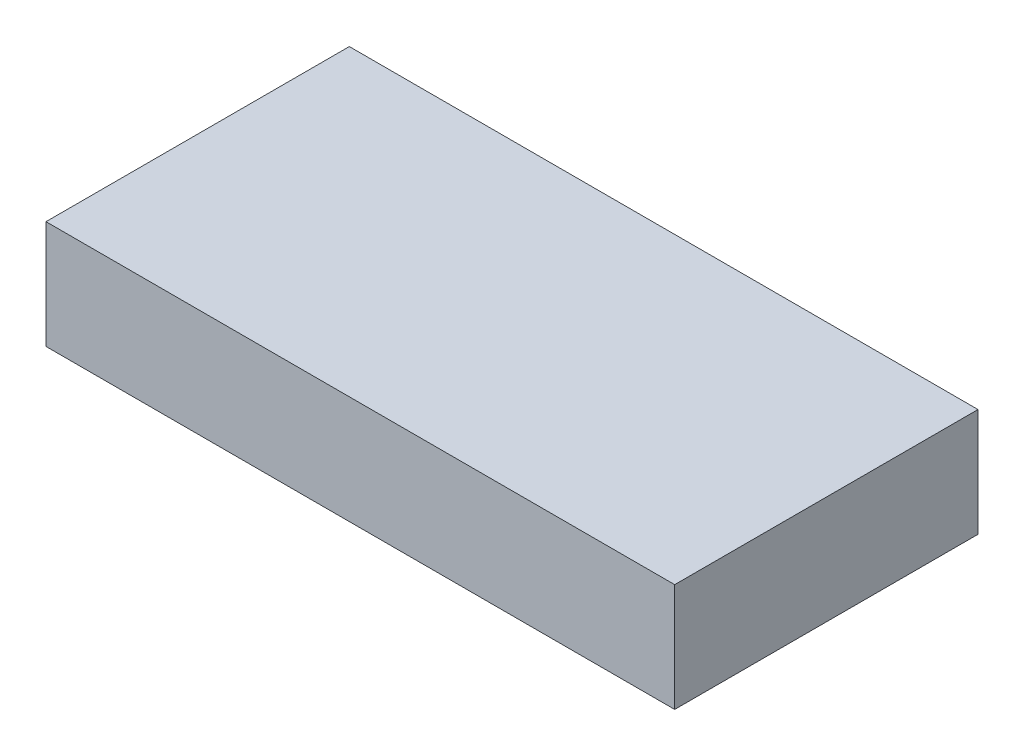
from build123d import *

# Parameters (mm, degrees)
SKETCH1_W           = 1140
SKETCH1_H           = 550
BOSS_EXTRUDE1_DEPTH = 196


with BuildPart() as part:
    # Sketch1 → Boss-Extrude1 (new body)
    with BuildSketch(Plane(origin=(0, 0, 0), x_dir=(1, 0, 0), z_dir=(0, 1, 0))):
        Rectangle(SKETCH1_W, SKETCH1_H)
    extrude(amount=BOSS_EXTRUDE1_DEPTH)


solid = part.part
